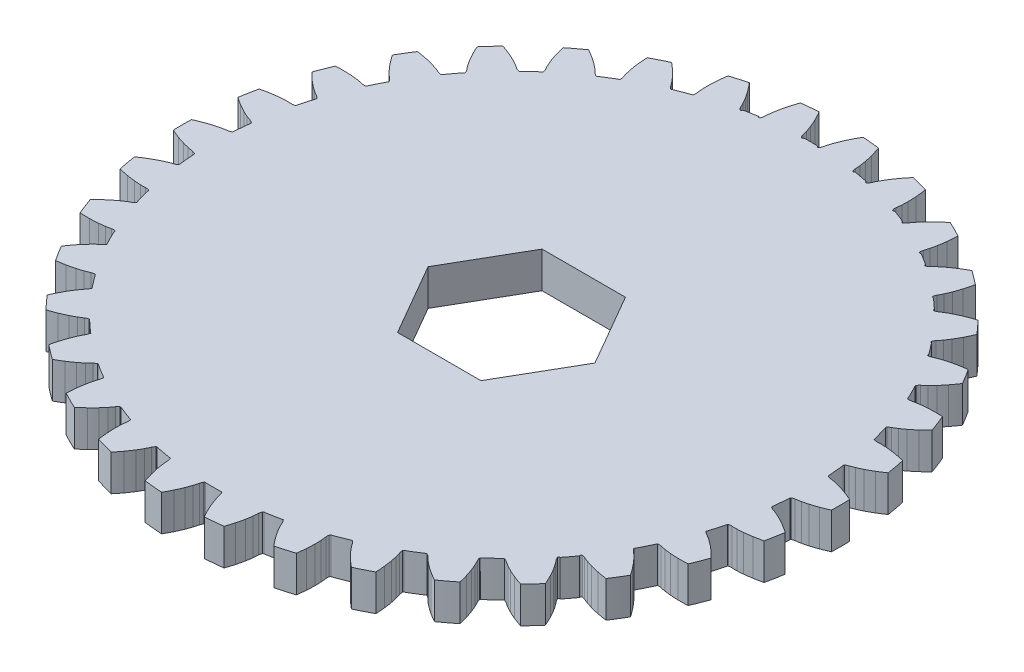
from build123d import *

# Parameters (mm, degrees)
BOSS_EXTRUDE1_DEPTH = 3.175


with BuildPart() as part:
    # Model → Boss-Extrude1 (new body)
    with BuildSketch(Plane(origin=(0, 0, 0), x_dir=(1, 0, 0), z_dir=(0, 1, 0))):
        with BuildLine():
            ThreePointArc((26.039547017, -3.158714239), (26.081656494, -2.789745335), (26.118538109, -2.420217249))
            ThreePointArc((26.118538109, -2.420217249), (26.15018278, -2.050225616), (26.176586464, -1.67982308))
            ThreePointArc((26.176586464, -1.67982308), (26.19430218, -1.656128647), (26.21828275, -1.638802221))
            ThreePointArc((26.21828275, -1.638802221), (26.349972724, -1.58470137), (26.488875474, -1.553473543))
            ThreePointArc((26.488875474, -1.553473543), (26.716015585, -1.517661861), (26.941580978, -1.472992407))
            ThreePointArc((26.941580978, -1.472992407), (27.208998909, -1.40997215), (27.474210372, -1.338231068))
            ThreePointArc((27.474210372, -1.338231068), (27.822373625, -1.230698091), (28.166198085, -1.110009516))
            ThreePointArc((28.166198085, -1.110009516), (28.547173014, -0.960699832), (28.922876054, -0.798581036))
            ThreePointArc((28.922876054, -0.798581036), (28.933898647, 0), (28.922876054, 0.798581036))
            ThreePointArc((28.922876054, 0.798581036), (28.547173011, 0.960699833), (28.166198079, 1.110009518))
            ThreePointArc((28.166198079, 1.110009518), (27.822373616, 1.230698094), (27.47421036, 1.338231071))
            ThreePointArc((27.47421036, 1.338231071), (27.208998897, 1.409972153), (26.941580965, 1.47299241))
            ThreePointArc((26.941580965, 1.47299241), (26.716015572, 1.517661864), (26.488875461, 1.553473545))
            ThreePointArc((26.488875461, 1.553473545), (26.349972724, 1.584701369), (26.218282762, 1.638802211))
            ThreePointArc((26.218282762, 1.638802211), (26.188796618, 1.65750247), (26.16748445, 1.685159727))
            ThreePointArc((26.16748445, 1.685159727), (26.111416775, 2.402273868), (26.035700465, 3.117580318))
            ThreePointArc((26.035700465, 3.117580318), (26.04260123, 3.167055317), (26.072995781, 3.206698314))
            ThreePointArc((26.072995781, 3.206698314), (26.192502478, 3.284075965), (26.323302047, 3.340295392))
            ThreePointArc((26.323302047, 3.340295392), (26.539994286, 3.417234198), (26.753511009, 3.502590602))
            ThreePointArc((26.753511009, 3.502590602), (27.0047957, 3.613675735), (27.252309044, 3.732927767))
            ThreePointArc((27.252309044, 3.732927767), (27.574785023, 3.902604621), (27.890578752, 4.084415822))
            ThreePointArc((27.890578752, 4.084415822), (28.237631276, 4.301187185), (28.577148007, 4.529580852))
            ThreePointArc((28.577148007, 4.529580852), (28.441244039, 5.316589925), (28.283670246, 6.099548205))
            ThreePointArc((28.283670246, 6.099548205), (27.884575011, 6.189871369), (27.482651318, 6.266634813))
            ThreePointArc((27.482651318, 6.266634813), (27.122504653, 6.322090857), (26.760510405, 6.36381805))
            ThreePointArc((26.760510405, 6.36381805), (26.486632282, 6.385605126), (26.212187706, 6.398414427))
            ThreePointArc((26.212187706, 6.398414427), (25.982255002, 6.400875766), (25.752402004, 6.394340799))
            ThreePointArc((25.752402004, 6.394340799), (25.610126253, 6.399513599), (25.470737559, 6.428495305))
            ThreePointArc((25.470737559, 6.428495305), (25.442493252, 6.434082805), (25.416780324, 6.447036816))
            ThreePointArc((25.416780324, 6.447036816), (25.227894102, 7.150549974), (25.019539308, 7.848544995))
            ThreePointArc((25.019539308, 7.848544995), (25.017231567, 7.8984456), (25.039824212, 7.942998585))
            ThreePointArc((25.039824212, 7.942998585), (25.143077974, 8.041018031), (25.261320139, 8.120314574))
            ThreePointArc((25.261320139, 8.120314574), (25.460185313, 8.235760445), (25.65438231, 8.358897088))
            ThreePointArc((25.65438231, 8.358897088), (25.880976562, 8.514264227), (26.102363017, 8.676966225))
            ThreePointArc((26.102363017, 8.676966225), (26.38817019, 8.903008813), (26.665179209, 9.139751279))
            ThreePointArc((26.665179209, 9.139751279), (26.966490872, 9.41660243), (27.258259459, 9.703493297))
            ThreePointArc((27.258259459, 9.703493297), (26.980056976, 10.452129756), (26.681297971, 11.192802576))
            ThreePointArc((26.681297971, 11.192802576), (26.272401252, 11.208254259), (25.863215829, 11.209857374))
            ThreePointArc((25.863215829, 11.209857374), (25.499011323, 11.198192398), (25.135513364, 11.172692838))
            ThreePointArc((25.135513364, 11.172692838), (24.862295171, 11.143783974), (24.590169834, 11.105946114))
            ThreePointArc((24.590169834, 11.105946114), (24.363699901, 11.06611552), (24.138961384, 11.017456446))
            ThreePointArc((24.138961384, 11.017456446), (23.998157648, 10.996398069), (23.855816937, 10.999273701))
            ThreePointArc((23.855816937, 10.999273701), (23.829640328, 10.995976243), (23.803412998, 10.998842458))
            ThreePointArc((23.803412998, 10.998842458), (23.486572972, 11.660098447), (23.151367748, 12.312236886))
            ThreePointArc((23.151367748, 12.312236886), (23.139930089, 12.360863792), (23.153951461, 12.408809565))
            ThreePointArc((23.153951461, 12.408809565), (23.237436106, 12.524132873), (23.339094271, 12.623806182))
            ThreePointArc((23.339094271, 12.623806182), (23.513360265, 12.773827747), (23.68162439, 12.93055136))
            ThreePointArc((23.68162439, 12.93055136), (23.875811807, 13.124909663), (24.063532324, 13.325521004))
            ThreePointArc((24.063532324, 13.325521004), (24.30293787, 13.600231718), (24.531728971, 13.883843467))
            ThreePointArc((24.531728971, 13.883843467), (24.793149492, 14.23368498), (25.041761869, 14.592741603))
            ThreePointArc((25.041761869, 14.592741603), (24.642190217, 15.257798213), (24.224960364, 15.911921328))
            ThreePointArc((24.224960364, 15.911921328), (23.79272998, 15.849417962), (23.363039544, 15.771341688))
            ThreePointArc((23.363039544, 15.771341688), (23.007179746, 15.692952927), (22.654556562, 15.601094971))
            ThreePointArc((22.654556562, 15.601094971), (22.391302418, 15.522474625), (22.13076322, 15.435278127))
            ThreePointArc((22.13076322, 15.435278127), (21.91546822, 15.354511984), (21.703497385, 15.265385829))
            ThreePointArc((21.703497385, 15.265385829), (21.568960567, 15.218813392), (21.428515081, 15.195485023))
            ThreePointArc((21.428515081, 15.195485023), (21.339460922, 15.238312212), (21.332995773, 15.336917553))
            ThreePointArc((21.332995773, 15.336917553), (20.967023721, 15.833561348), (20.58949199, 16.321475677))
            ThreePointArc((20.58949199, 16.321475677), (20.496420127, 16.354678643), (20.479598664, 16.452053418))
            ThreePointArc((20.479598664, 16.452053418), (20.540471221, 16.580753391), (20.622083541, 16.697409211))
            ThreePointArc((20.622083541, 16.697409211), (20.765815935, 16.876897667), (20.902417155, 17.061871214))
            ThreePointArc((20.902417155, 17.061871214), (21.057584918, 17.288602041), (21.205246899, 17.520291148))
            ThreePointArc((21.205246899, 17.520291148), (21.390098149, 17.834315043), (21.562880125, 18.155138018))
            ThreePointArc((21.562880125, 18.155138018), (21.758877489, 18.554118686), (21.940072505, 18.960036049))
            ThreePointArc((21.940072505, 18.960036049), (21.42934408, 19.535428351), (20.903530375, 20.097068602))
            ThreePointArc((20.903530375, 20.097068602), (20.482626013, 19.95409986), (20.067262968, 19.795751876))
            ThreePointArc((20.067262968, 19.795751876), (19.731866256, 19.653308767), (19.402126007, 19.498220527))
            ThreePointArc((19.402126007, 19.498220527), (19.157800716, 19.372566019), (18.917720007, 19.238980255))
            ThreePointArc((18.917720007, 19.238980255), (18.720931554, 19.120028957), (18.528946813, 18.993470805))
            ThreePointArc((18.528946813, 18.993470805), (18.405258403, 18.922970277), (18.271490845, 18.874232328))
            ThreePointArc((18.271490845, 18.874232328), (18.171589021, 18.904840123), (18.156103069, 19.008171613))
            ThreePointArc((18.156103069, 19.008171613), (17.70877484, 19.425600644), (17.251852246, 19.832505158))
            ThreePointArc((17.251852246, 19.832505158), (17.147532701, 19.838390811), (17.107837696, 19.935042324))
            ThreePointArc((17.107837696, 19.935042324), (17.144025225, 20.072736238), (17.202812489, 20.202401996))
            ThreePointArc((17.202812489, 20.202401996), (17.311116648, 20.405245077), (17.411403173, 20.612169507))
            ThreePointArc((17.411403173, 20.612169507), (17.52226723, 20.863551813), (17.624842223, 21.11842879))
            ThreePointArc((17.624842223, 21.11842879), (17.748844291, 21.46107216), (17.859733257, 21.808181118))
            ThreePointArc((17.859733257, 21.808181118), (17.980764446, 22.242890471), (18.085486232, 22.681814289))
            ThreePointArc((18.085486232, 22.681814289), (17.482113088, 23.150059043), (16.866622377, 23.602257546))
            ThreePointArc((16.866622377, 23.602257546), (16.473112668, 23.381416241), (16.08811982, 23.146041476))
            ThreePointArc((16.08811982, 23.146041476), (15.784607727, 22.944394748), (15.488979322, 22.731357568))
            ThreePointArc((15.488979322, 22.731357568), (15.271903088, 22.562947913), (15.060456529, 22.387521986))
            ThreePointArc((15.060456529, 22.387521986), (14.888876017, 22.234436276), (14.723415181, 22.074755914))
            ThreePointArc((14.723415181, 22.074755914), (14.614787239, 21.982728105), (14.492252902, 21.910240288))
            ThreePointArc((14.492252902, 21.910240288), (14.384331279, 21.925436409), (14.357220474, 22.030996833))
            ThreePointArc((14.357220474, 22.030996833), (13.843210143, 22.357552059), (13.321775772, 22.672117048))
            ThreePointArc((13.321775772, 22.672117048), (13.215197647, 22.649333307), (13.153489834, 22.739167273))
            ThreePointArc((13.153489834, 22.739167273), (13.163760011, 22.881166128), (13.19772029, 23.019426211))
            ThreePointArc((13.19772029, 23.019426211), (13.266908047, 23.238716341), (13.327464739, 23.460545089))
            ThreePointArc((13.327464739, 23.460545089), (13.390249747, 23.72801835), (13.444244684, 23.997403668))
            ThreePointArc((13.444244684, 23.997403668), (13.503174827, 24.356998204), (13.548394595, 24.718572767))
            ThreePointArc((13.548394595, 24.718572767), (13.587856271, 25.173548487), (13.610103634, 25.629690114))
            ThreePointArc((13.610103634, 25.629690114), (12.934985606, 25.976952933), (12.251014386, 26.306436148))
            ThreePointArc((12.251014386, 26.306436148), (11.900412538, 26.013795623), (11.561115047, 25.708120395))
            ThreePointArc((11.561115047, 25.708120395), (11.299823313, 25.454136884), (11.048374022, 25.190405491))
            ThreePointArc((11.048374022, 25.190405491), (10.865939117, 24.984975676), (10.690327267, 24.773683506))
            ThreePointArc((10.690327267, 24.773683506), (10.549797665, 24.591676535), (10.416495303, 24.404311685))
            ThreePointArc((10.416495303, 24.404311685), (10.326627024, 24.293890493), (10.219498669, 24.200121294))
            ThreePointArc((10.219498669, 24.200121294), (10.107150905, 24.197432846), (10.066174138, 24.302075822))
            ThreePointArc((10.066174138, 24.302075822), (9.502226677, 24.528074511), (8.933210143, 24.740988412))
            ThreePointArc((8.933210143, 24.740988412), (8.83243045, 24.691262183), (8.751215652, 24.768937153))
            ThreePointArc((8.751215652, 24.768937153), (8.735218739, 24.910405347), (8.743195555, 25.052551475))
            ThreePointArc((8.743195555, 25.052551475), (8.770910804, 25.28082099), (8.789675477, 25.509999946))
            ThreePointArc((8.789675477, 25.509999946), (8.802243369, 25.784455681), (8.805819518, 26.059175746))
            ThreePointArc((8.805819518, 26.059175746), (8.79767094, 26.423475887), (8.775681604, 26.787203066))
            ThreePointArc((8.775681604, 26.787203066), (8.730404112, 27.245633562), (8.667692096, 27.702005969))
            ThreePointArc((8.667692096, 27.702005969), (7.943442572, 27.918304767), (7.213806571, 28.115672066))
            ThreePointArc((7.213806571, 28.115672066), (6.920238625, 27.760670045), (6.640410367, 27.394740107))
            ThreePointArc((6.640410367, 27.394740107), (6.430236969, 27.097068918), (6.231529597, 26.791624367))
            ThreePointArc((6.231529597, 26.791624367), (6.089948622, 26.55617006), (5.956151732, 26.316206947))
            ThreePointArc((5.956151732, 26.316206947), (5.851458606, 26.111476744), (5.754854171, 25.902807892))
            ThreePointArc((5.754854171, 25.902807892), (5.686805911, 25.777753578), (5.598731665, 25.665896194))
            ThreePointArc((5.598731665, 25.665896194), (5.486245297, 25.643734929), (5.429734672, 25.743488896))
            ThreePointArc((5.429734672, 25.743488896), (4.834425845, 25.86189409), (4.236544006, 25.966534887))
            ThreePointArc((4.236544006, 25.966534887), (4.14781415, 25.893931074), (4.050929317, 25.955230586))
            ThreePointArc((4.050929317, 25.955230586), (4.009210069, 26.09135059), (3.990931782, 26.232542146))
            ThreePointArc((3.990931782, 26.232542146), (3.976230713, 26.462017603), (3.95256436, 26.69074235))
            ThreePointArc((3.95256436, 26.69074235), (3.91448715, 26.962834299), (3.867522728, 27.233533848))
            ThreePointArc((3.867522728, 27.233533848), (3.792572921, 27.59013379), (3.704123301, 27.943627293))
            ThreePointArc((3.704123301, 27.943627293), (3.57467779, 28.388184485), (3.428301751, 28.827458082))
            ThreePointArc((3.428301751, 28.827458082), (2.678605607, 28.906758109), (1.927103124, 28.966564621))
            ThreePointArc((1.927103124, 28.966564621), (1.702503102, 28.561667015), (1.493574476, 28.148464801))
            ThreePointArc((1.493574476, 28.148464801), (1.341676617, 27.817242769), (1.202477904, 27.480486608))
            ThreePointArc((1.202477904, 27.480486608), (1.10657223, 27.223025922), (1.019146593, 26.962563523))
            ThreePointArc((1.019146593, 26.962563523), (0.953855143, 26.74208193), (0.897238383, 26.519215043))
            ThreePointArc((0.897238383, 26.519215043), (0.853327443, 26.383786182), (0.787306569, 26.257649782))
            ThreePointArc((0.787306569, 26.257649782), (0.679502068, 26.215533389), (0.606763679, 26.305559649))
            ThreePointArc((0.606763679, 26.305559649), (-1.1e-08, 26.31255652), (-0.606763701, 26.305559649))
            ThreePointArc((-0.606763701, 26.305559649), (-0.679502069, 26.21553339), (-0.787306558, 26.25764977))
            ThreePointArc((-0.787306558, 26.25764977), (-0.853327442, 26.383786181), (-0.897238386, 26.519215057))
            ThreePointArc((-0.897238386, 26.519215057), (-0.953855146, 26.742081943), (-1.019146597, 26.962563536))
            ThreePointArc((-1.019146597, 26.962563536), (-1.106572234, 27.223025934), (-1.202477909, 27.480486619))
            ThreePointArc((-1.202477909, 27.480486619), (-1.341676621, 27.817242778), (-1.493574479, 28.148464807))
            ThreePointArc((-1.493574479, 28.148464807), (-1.702792839, 28.562213735), (-1.927724072, 28.967635045))
            ThreePointArc((-1.927724072, 28.967635045), (-2.67870796, 28.907862665), (-3.427888065, 28.828624379))
            ThreePointArc((-3.427888065, 28.828624379), (-3.574493448, 28.388775129), (-3.704123302, 27.943627286))
            ThreePointArc((-3.704123302, 27.943627286), (-3.792572923, 27.590133781), (-3.867522731, 27.233533837))
            ThreePointArc((-3.867522731, 27.233533837), (-3.914487151, 26.962834287), (-3.952564361, 26.690742337))
            ThreePointArc((-3.952564361, 26.690742337), (-3.976230714, 26.462017589), (-3.990931783, 26.232542133))
            ThreePointArc((-3.990931783, 26.232542133), (-4.009210067, 26.09135059), (-4.050929308, 25.955230599))
            ThreePointArc((-4.050929308, 25.955230599), (-4.14897935, 25.894009007), (-4.237117681, 25.968798903))
            ThreePointArc((-4.237117681, 25.968798903), (-4.834853424, 25.864181314), (-5.430017636, 25.745807254))
            ThreePointArc((-5.430017636, 25.745807254), (-5.485186935, 25.644228522), (-5.598731652, 25.665896185))
            ThreePointArc((-5.598731652, 25.665896185), (-5.686805909, 25.777753578), (-5.754854177, 25.902807905))
            ThreePointArc((-5.754854177, 25.902807905), (-5.851458612, 26.111476756), (-5.956151738, 26.316206959))
            ThreePointArc((-5.956151738, 26.316206959), (-6.089948628, 26.55617007), (-6.231529603, 26.791624377))
            ThreePointArc((-6.231529603, 26.791624377), (-6.430236974, 27.097068926), (-6.64041037, 27.394740112))
            ThreePointArc((-6.64041037, 27.394740112), (-6.921344677, 27.762060476), (-7.21612322, 28.118366447))
            ThreePointArc((-7.21612322, 28.118366447), (-7.944314362, 27.921368793), (-8.66714085, 27.705516336))
            ThreePointArc((-8.66714085, 27.705516336), (-8.730195696, 27.247397985), (-8.775681604, 26.787203059))
            ThreePointArc((-8.775681604, 26.787203059), (-8.79767094, 26.423475878), (-8.805819518, 26.059175734))
            ThreePointArc((-8.805819518, 26.059175734), (-8.802243368, 25.784455669), (-8.789675476, 25.509999932))
            ThreePointArc((-8.789675476, 25.509999932), (-8.770910802, 25.280820977), (-8.743195553, 25.052551462))
            ThreePointArc((-8.743195553, 25.052551462), (-8.735218737, 24.910405348), (-8.751215646, 24.768937167))
            ThreePointArc((-8.751215646, 24.768937167), (-8.743605771, 24.746062493), (-8.740091863, 24.722212684))
            ThreePointArc((-8.740091863, 24.722212684), (-9.435606495, 24.465206637), (-10.123576332, 24.188637994))
            ThreePointArc((-10.123576332, 24.188637994), (-10.173051139, 24.18173585), (-10.219498654, 24.200121288))
            ThreePointArc((-10.219498654, 24.200121288), (-10.326627022, 24.293890494), (-10.416495311, 24.404311697))
            ThreePointArc((-10.416495311, 24.404311697), (-10.549797673, 24.591676546), (-10.690327276, 24.773683516))
            ThreePointArc((-10.690327276, 24.773683516), (-10.865939125, 24.984975686), (-11.04837403, 25.190405499))
            ThreePointArc((-11.04837403, 25.190405499), (-11.299823319, 25.454136891), (-11.561115051, 25.7081204))
            ThreePointArc((-11.561115051, 25.7081204), (-11.864586738, 25.982602118), (-12.177174788, 26.246655122))
            ThreePointArc((-12.177174788, 26.246655122), (-12.896948409, 25.900563944), (-13.606895645, 25.534738726))
            ThreePointArc((-13.606895645, 25.534738726), (-13.584553185, 25.126160587), (-13.548394594, 24.71857276))
            ThreePointArc((-13.548394594, 24.71857276), (-13.503174826, 24.356998195), (-13.444244682, 23.997403656))
            ThreePointArc((-13.444244682, 23.997403656), (-13.390249744, 23.728018338), (-13.327464735, 23.460545076))
            ThreePointArc((-13.327464735, 23.460545076), (-13.266908043, 23.238716328), (-13.197720285, 23.019426198))
            ThreePointArc((-13.197720285, 23.019426198), (-13.16376001, 22.881166128), (-13.153489831, 22.739167288))
            ThreePointArc((-13.153489831, 22.739167288), (-13.142387478, 22.717653893), (-13.135326412, 22.694497258))
            ThreePointArc((-13.135326412, 22.694497258), (-13.771084204, 22.314440293), (-14.395853775, 21.916578196))
            ThreePointArc((-14.395853775, 21.916578196), (-14.443217913, 21.900702603), (-14.492252887, 21.910240285))
            ThreePointArc((-14.492252887, 21.910240285), (-14.614787238, 21.982728106), (-14.72341519, 22.074755923))
            ThreePointArc((-14.72341519, 22.074755923), (-14.888876027, 22.234436285), (-15.060456539, 22.387521994))
            ThreePointArc((-15.060456539, 22.387521994), (-15.271903098, 22.562947921), (-15.488979331, 22.731357575))
            ThreePointArc((-15.488979331, 22.731357575), (-15.784607734, 22.944394753), (-16.088119825, 23.14604148))
            ThreePointArc((-16.088119825, 23.14604148), (-16.436860213, 23.360086849), (-16.792645469, 23.562205946))
            ThreePointArc((-16.792645469, 23.562205946), (-17.43656949, 23.089749572), (-18.067208318, 22.599700761))
            ThreePointArc((-18.067208318, 22.599700761), (-17.970170244, 22.202184858), (-17.859733256, 21.808181112))
            ThreePointArc((-17.859733256, 21.808181112), (-17.748844288, 21.461072151), (-17.624842219, 21.118428779))
            ThreePointArc((-17.624842219, 21.118428779), (-17.522267225, 20.863551801), (-17.411403167, 20.612169495))
            ThreePointArc((-17.411403167, 20.612169495), (-17.311116642, 20.405245065), (-17.202812482, 20.202401984))
            ThreePointArc((-17.202812482, 20.202401984), (-17.144025224, 20.072736239), (-17.107837695, 19.935042339))
            ThreePointArc((-17.107837695, 19.935042339), (-17.093770168, 19.915068932), (-17.083717189, 19.892803039))
            ThreePointArc((-17.083717189, 19.892803039), (-17.637819927, 19.403203703), (-18.177897684, 18.898175614))
            ThreePointArc((-18.177897684, 18.898175614), (-18.221538225, 18.873867195), (-18.271490829, 18.874232327))
            ThreePointArc((-18.271490829, 18.874232327), (-18.405258402, 18.922970278), (-18.528946824, 18.993470813))
            ThreePointArc((-18.528946824, 18.993470813), (-18.720931566, 19.120028964), (-18.917720019, 19.238980262))
            ThreePointArc((-18.917720019, 19.238980262), (-19.157800727, 19.372566025), (-19.402126018, 19.498220532))
            ThreePointArc((-19.402126018, 19.498220532), (-19.731866264, 19.653308771), (-20.067262974, 19.795751879))
            ThreePointArc((-20.067262974, 19.795751879), (-20.449396127, 19.942071841), (-20.83626275, 20.075374106))
            ThreePointArc((-20.83626275, 20.075374106), (-21.38240911, 19.492641472), (-21.912263881, 18.895057092))
            ThreePointArc((-21.912263881, 18.895057092), (-21.743834709, 18.522140352), (-21.562880121, 18.155138012))
            ThreePointArc((-21.562880121, 18.155138012), (-21.390098145, 17.834315035), (-21.205246893, 17.520291138))
            ThreePointArc((-21.205246893, 17.520291138), (-21.057584911, 17.288602031), (-20.902417147, 17.061871203))
            ThreePointArc((-20.902417147, 17.061871203), (-20.765815926, 16.876897656), (-20.622083532, 16.697409201))
            ThreePointArc((-20.622083532, 16.697409201), (-20.54047122, 16.580753392), (-20.479598666, 16.452053433))
            ThreePointArc((-20.479598666, 16.452053433), (-20.463039822, 16.4334639), (-20.45057791, 16.411912408))
            ThreePointArc((-20.45057791, 16.411912408), (-20.904013632, 15.830325955), (-21.340915089, 15.236218327))
            ThreePointArc((-21.340915089, 15.236218327), (-21.379345906, 15.204304877), (-21.428515066, 15.195485025))
            ThreePointArc((-21.428515066, 15.195485025), (-21.568960566, 15.218813393), (-21.703497397, 15.265385834))
            ThreePointArc((-21.703497397, 15.265385834), (-21.915468233, 15.354511989), (-22.130763232, 15.435278131))
            ThreePointArc((-22.130763232, 15.435278131), (-22.39130243, 15.522474628), (-22.654556573, 15.601094975))
            ThreePointArc((-22.654556573, 15.601094975), (-23.007179754, 15.692952929), (-23.36303955, 15.771341689))
            ThreePointArc((-23.36303955, 15.771341689), (-23.765552383, 15.844953493), (-24.170326093, 15.904899479))
            ThreePointArc((-24.170326093, 15.904899479), (-24.600096433, 15.231734845), (-25.011123578, 14.546964916))
            ThreePointArc((-25.011123578, 14.546964916), (-24.777038962, 14.211346572), (-24.531728967, 13.883843462))
            ThreePointArc((-24.531728967, 13.883843462), (-24.302937864, 13.600231711), (-24.063532316, 13.325520995))
            ThreePointArc((-24.063532316, 13.325520995), (-23.875811799, 13.124909653), (-23.68162438, 12.930551351))
            ThreePointArc((-23.68162438, 12.930551351), (-23.513360255, 12.773827738), (-23.339094261, 12.623806174))
            ThreePointArc((-23.339094261, 12.623806174), (-23.237436105, 12.524132874), (-23.153951466, 12.408809579))
            ThreePointArc((-23.153951466, 12.408809579), (-23.135182164, 12.390988008), (-23.120861787, 12.369428279))
            ThreePointArc((-23.120861787, 12.369428279), (-23.458229944, 11.717015561), (-23.777193226, 11.055409899))
            ThreePointArc((-23.777193226, 11.055409899), (-23.809105605, 11.016978192), (-23.855816922, 10.999273706))
            ThreePointArc((-23.855816922, 10.999273706), (-23.998157647, 10.99639807), (-24.138961397, 11.017456449))
            ThreePointArc((-24.138961397, 11.017456449), (-24.363699914, 11.066115523), (-24.590169847, 11.105946116))
            ThreePointArc((-24.590169847, 11.105946116), (-24.862295184, 11.143783976), (-25.135513376, 11.172692839))
            ThreePointArc((-25.135513376, 11.172692839), (-25.499011332, 11.198192398), (-25.863215835, 11.209857374))
            ThreePointArc((-25.863215835, 11.209857374), (-26.272401256, 11.208254259), (-26.681297971, 11.192802576))
            ThreePointArc((-26.681297971, 11.192802576), (-26.980056976, 10.452129756), (-27.258259459, 9.703493297))
            ThreePointArc((-27.258259459, 9.703493297), (-26.966490869, 9.416602428), (-26.665179204, 9.139751274))
            ThreePointArc((-26.665179204, 9.139751274), (-26.388170183, 8.903008807), (-26.102363008, 8.676966218))
            ThreePointArc((-26.102363008, 8.676966218), (-25.880976551, 8.51426422), (-25.654382299, 8.358897081))
            ThreePointArc((-25.654382299, 8.358897081), (-25.460185302, 8.235760438), (-25.261320127, 8.120314568))
            ThreePointArc((-25.261320127, 8.120314568), (-25.143077974, 8.041018033), (-25.03982422, 7.942998598))
            ThreePointArc((-25.03982422, 7.942998598), (-25.018642166, 7.924542889), (-25.002947755, 7.901240999))
            ThreePointArc((-25.002947755, 7.901240999), (-25.213120048, 7.202470632), (-25.403767565, 6.498122747))
            ThreePointArc((-25.403767565, 6.498122747), (-25.428074768, 6.454481528), (-25.470737545, 6.428495312))
            ThreePointArc((-25.470737545, 6.428495312), (-25.610126252, 6.3995136), (-25.752402018, 6.394340799))
            ThreePointArc((-25.752402018, 6.394340799), (-25.982255016, 6.400875766), (-26.21218772, 6.398414426))
            ThreePointArc((-26.21218772, 6.398414426), (-26.486632294, 6.385605125), (-26.760510417, 6.363818049))
            ThreePointArc((-26.760510417, 6.363818049), (-27.122504662, 6.322090855), (-27.482651325, 6.266634811))
            ThreePointArc((-27.482651325, 6.266634811), (-27.884575014, 6.189871368), (-28.283670246, 6.099548205))
            ThreePointArc((-28.283670246, 6.099548205), (-28.441244039, 5.316589925), (-28.577148007, 4.529580852))
            ThreePointArc((-28.577148007, 4.529580852), (-28.237631273, 4.301187183), (-27.890578746, 4.084415819))
            ThreePointArc((-27.890578746, 4.084415819), (-27.574785015, 3.902604616), (-27.252309033, 3.732927762))
            ThreePointArc((-27.252309033, 3.732927762), (-27.004795688, 3.61367573), (-26.753510997, 3.502590596))
            ThreePointArc((-26.753510997, 3.502590596), (-26.539994274, 3.417234193), (-26.323302034, 3.340295388))
            ThreePointArc((-26.323302034, 3.340295388), (-26.192502478, 3.284075966), (-26.072995791, 3.206698326))
            ThreePointArc((-26.072995791, 3.206698326), (-26.04762693, 3.183829267), (-26.031336753, 3.153809223))
            ThreePointArc((-26.031336753, 3.153809223), (-26.108142708, 2.437599245), (-26.165247069, 1.719549818))
            ThreePointArc((-26.165247069, 1.719549818), (-26.181121342, 1.672185237), (-26.21828275, 1.638802221))
            ThreePointArc((-26.21828275, 1.638802221), (-26.349972724, 1.58470137), (-26.488875474, 1.553473543))
            ThreePointArc((-26.488875474, 1.553473543), (-26.716015585, 1.517661861), (-26.941580978, 1.472992407))
            ThreePointArc((-26.941580978, 1.472992407), (-27.208998909, 1.40997215), (-27.474210372, 1.338231068))
            ThreePointArc((-27.474210372, 1.338231068), (-27.822373625, 1.230698091), (-28.166198085, 1.110009516))
            ThreePointArc((-28.166198085, 1.110009516), (-28.547173014, 0.960699832), (-28.922876054, 0.798581036))
            ThreePointArc((-28.922876054, 0.798581036), (-28.933898647, 0), (-28.922876054, -0.798581036))
            ThreePointArc((-28.922876054, -0.798581036), (-28.547173011, -0.960699833), (-28.166198079, -1.110009518))
            ThreePointArc((-28.166198079, -1.110009518), (-27.822373616, -1.230698094), (-27.47421036, -1.338231071))
            ThreePointArc((-27.47421036, -1.338231071), (-27.208998897, -1.409972153), (-26.941580965, -1.47299241))
            ThreePointArc((-26.941580965, -1.47299241), (-26.716015572, -1.517661864), (-26.488875461, -1.553473545))
            ThreePointArc((-26.488875461, -1.553473545), (-26.349972724, -1.584701369), (-26.218282762, -1.638802211))
            ThreePointArc((-26.218282762, -1.638802211), (-26.171313035, -1.691469631), (-26.17191353, -1.762036278))
            ThreePointArc((-26.17191353, -1.762036278), (-26.115359118, -2.46208201), (-26.040083277, -3.160362739))
            ThreePointArc((-26.040083277, -3.160362739), (-26.053106056, -3.185969348), (-26.072995781, -3.206698314))
            ThreePointArc((-26.072995781, -3.206698314), (-26.192502478, -3.284075965), (-26.323302047, -3.340295392))
            ThreePointArc((-26.323302047, -3.340295392), (-26.539994286, -3.417234198), (-26.753511009, -3.502590602))
            ThreePointArc((-26.753511009, -3.502590602), (-27.0047957, -3.613675735), (-27.252309044, -3.732927767))
            ThreePointArc((-27.252309044, -3.732927767), (-27.574785023, -3.902604621), (-27.890578752, -4.084415822))
            ThreePointArc((-27.890578752, -4.084415822), (-28.246780691, -4.307125444), (-28.595028735, -4.542077985))
            ThreePointArc((-28.595028735, -4.542077985), (-28.460528252, -5.320194769), (-28.304858014, -6.09435424))
            ThreePointArc((-28.304858014, -6.09435424), (-27.895251733, -6.187639257), (-27.482651318, -6.266634813))
            ThreePointArc((-27.482651318, -6.266634813), (-27.122504653, -6.322090857), (-26.760510405, -6.36381805))
            ThreePointArc((-26.760510405, -6.36381805), (-26.486632282, -6.385605126), (-26.212187706, -6.398414427))
            ThreePointArc((-26.212187706, -6.398414427), (-25.982255002, -6.400875766), (-25.752402004, -6.394340799))
            ThreePointArc((-25.752402004, -6.394340799), (-25.610126253, -6.399513599), (-25.470737559, -6.428495305))
            ThreePointArc((-25.470737559, -6.428495305), (-25.407829004, -6.485741359), (-25.413393337, -6.570615591))
            ThreePointArc((-25.413393337, -6.570615591), (-25.228374999, -7.248630563), (-25.025271088, -7.921449178))
            ThreePointArc((-25.025271088, -7.921449178), (-25.031829598, -7.932708809), (-25.039824212, -7.942998585))
            ThreePointArc((-25.039824212, -7.942998585), (-25.143077974, -8.041018031), (-25.261320139, -8.120314574))
            ThreePointArc((-25.261320139, -8.120314574), (-25.460185313, -8.235760445), (-25.65438231, -8.358897088))
            ThreePointArc((-25.65438231, -8.358897088), (-25.880976562, -8.514264227), (-26.102363017, -8.676966225))
            ThreePointArc((-26.102363017, -8.676966225), (-26.38817019, -8.903008813), (-26.665179209, -9.139751279))
            ThreePointArc((-26.665179209, -9.139751279), (-26.981883595, -9.431259495), (-27.28800839, -9.733858764))
            ThreePointArc((-27.28800839, -9.733858764), (-27.015692033, -10.465934851), (-26.723739779, -11.19040395))
            ThreePointArc((-26.723739779, -11.19040395), (-26.293651012, -11.207792568), (-25.863215829, -11.209857374))
            ThreePointArc((-25.863215829, -11.209857374), (-25.499011323, -11.198192398), (-25.135513364, -11.172692838))
            ThreePointArc((-25.135513364, -11.172692838), (-24.862295171, -11.143783974), (-24.590169834, -11.105946114))
            ThreePointArc((-24.590169834, -11.105946114), (-24.363699901, -11.06611552), (-24.138961384, -11.017456446))
            ThreePointArc((-24.138961384, -11.017456446), (-23.998157648, -10.996398069), (-23.855816937, -10.999273701))
            ThreePointArc((-23.855816937, -10.999273701), (-23.778189878, -11.053330716), (-23.782445156, -11.147829466))
            ThreePointArc((-23.782445156, -11.147829466), (-23.475469745, -11.780539871), (-23.151665373, -12.404805111))
            ThreePointArc((-23.151665373, -12.404805111), (-23.152784857, -12.406820788), (-23.153951461, -12.408809565))
            ThreePointArc((-23.153951461, -12.408809565), (-23.237436106, -12.524132873), (-23.339094271, -12.623806182))
            ThreePointArc((-23.339094271, -12.623806182), (-23.513360265, -12.773827747), (-23.68162439, -12.93055136))
            ThreePointArc((-23.68162439, -12.93055136), (-23.875811807, -13.124909663), (-24.063532324, -13.325521004))
            ThreePointArc((-24.063532324, -13.325521004), (-24.30293787, -13.600231718), (-24.531728971, -13.883843467))
            ThreePointArc((-24.531728971, -13.883843467), (-24.777038964, -14.211346574), (-25.011123578, -14.546964916))
            ThreePointArc((-25.011123578, -14.546964916), (-24.600096433, -15.231734845), (-24.170326093, -15.904899479))
            ThreePointArc((-24.170326093, -15.904899479), (-23.765552379, -15.844953493), (-23.363039544, -15.771341688))
            ThreePointArc((-23.363039544, -15.771341688), (-23.007179746, -15.692952927), (-22.654556562, -15.601094971))
            ThreePointArc((-22.654556562, -15.601094971), (-22.391302418, -15.522474625), (-22.13076322, -15.435278127))
            ThreePointArc((-22.13076322, -15.435278127), (-21.91546822, -15.354511984), (-21.703497385, -15.265385829))
            ThreePointArc((-21.703497385, -15.265385829), (-21.568960567, -15.218813392), (-21.428515081, -15.195485023))
            ThreePointArc((-21.428515081, -15.195485023), (-21.379345923, -15.20430487), (-21.3409151, -15.236218311))
            ThreePointArc((-21.3409151, -15.236218311), (-20.904013639, -15.830325945), (-20.450577914, -16.411912404))
            ThreePointArc((-20.450577914, -16.411912404), (-20.463039823, -16.43346389), (-20.479598664, -16.452053418))
            ThreePointArc((-20.479598664, -16.452053418), (-20.540471221, -16.580753391), (-20.622083541, -16.697409211))
            ThreePointArc((-20.622083541, -16.697409211), (-20.765815935, -16.876897667), (-20.902417155, -17.061871214))
            ThreePointArc((-20.902417155, -17.061871214), (-21.057584918, -17.288602041), (-21.205246899, -17.520291148))
            ThreePointArc((-21.205246899, -17.520291148), (-21.390098149, -17.834315043), (-21.562880125, -18.155138018))
            ThreePointArc((-21.562880125, -18.155138018), (-21.743834711, -18.522140355), (-21.912263881, -18.895057092))
            ThreePointArc((-21.912263881, -18.895057092), (-21.38240911, -19.492641472), (-20.83626275, -20.075374106))
            ThreePointArc((-20.83626275, -20.075374106), (-20.449396124, -19.94207184), (-20.067262968, -19.795751876))
            ThreePointArc((-20.067262968, -19.795751876), (-19.731866256, -19.653308767), (-19.402126007, -19.498220527))
            ThreePointArc((-19.402126007, -19.498220527), (-19.157800716, -19.372566019), (-18.917720007, -19.238980255))
            ThreePointArc((-18.917720007, -19.238980255), (-18.720931554, -19.120028957), (-18.528946813, -18.993470805))
            ThreePointArc((-18.528946813, -18.993470805), (-18.405258403, -18.922970277), (-18.271490845, -18.874232328))
            ThreePointArc((-18.271490845, -18.874232328), (-18.221538242, -18.873867192), (-18.177897698, -18.8981756))
            ThreePointArc((-18.177897698, -18.8981756), (-17.637819937, -19.403203695), (-17.083717193, -19.892803035))
            ThreePointArc((-17.083717193, -19.892803035), (-17.093770171, -19.915068922), (-17.107837696, -19.935042324))
            ThreePointArc((-17.107837696, -19.935042324), (-17.144025225, -20.072736238), (-17.202812489, -20.202401996))
            ThreePointArc((-17.202812489, -20.202401996), (-17.311116648, -20.405245077), (-17.411403173, -20.612169507))
            ThreePointArc((-17.411403173, -20.612169507), (-17.52226723, -20.863551813), (-17.624842223, -21.11842879))
            ThreePointArc((-17.624842223, -21.11842879), (-17.748844291, -21.46107216), (-17.859733257, -21.808181118))
            ThreePointArc((-17.859733257, -21.808181118), (-17.970170245, -22.202184861), (-18.067208318, -22.599700761))
            ThreePointArc((-18.067208318, -22.599700761), (-17.43656949, -23.089749572), (-16.792645469, -23.562205946))
            ThreePointArc((-16.792645469, -23.562205946), (-16.43686021, -23.360086848), (-16.08811982, -23.146041476))
            ThreePointArc((-16.08811982, -23.146041476), (-15.784607727, -22.944394748), (-15.488979322, -22.731357568))
            ThreePointArc((-15.488979322, -22.731357568), (-15.271903088, -22.562947913), (-15.060456529, -22.387521986))
            ThreePointArc((-15.060456529, -22.387521986), (-14.888876017, -22.234436276), (-14.723415181, -22.074755914))
            ThreePointArc((-14.723415181, -22.074755914), (-14.614787239, -21.982728105), (-14.492252902, -21.910240288))
            ThreePointArc((-14.492252902, -21.910240288), (-14.443217931, -21.900702602), (-14.395853792, -21.916578185))
            ThreePointArc((-14.395853792, -21.916578185), (-13.771084215, -22.314440286), (-13.135326417, -22.694497255))
            ThreePointArc((-13.135326417, -22.694497255), (-13.142387483, -22.717653884), (-13.153489834, -22.739167273))
            ThreePointArc((-13.153489834, -22.739167273), (-13.163760011, -22.881166128), (-13.19772029, -23.019426211))
            ThreePointArc((-13.19772029, -23.019426211), (-13.266908047, -23.238716341), (-13.327464739, -23.460545089))
            ThreePointArc((-13.327464739, -23.460545089), (-13.390249747, -23.72801835), (-13.444244684, -23.997403668))
            ThreePointArc((-13.444244684, -23.997403668), (-13.503174827, -24.356998204), (-13.548394595, -24.718572767))
            ThreePointArc((-13.548394595, -24.718572767), (-13.584553185, -25.126160591), (-13.606895645, -25.534738726))
            ThreePointArc((-13.606895645, -25.534738726), (-12.896948409, -25.900563944), (-12.177174788, -26.246655122))
            ThreePointArc((-12.177174788, -26.246655122), (-11.864586735, -25.982602116), (-11.561115047, -25.708120395))
            ThreePointArc((-11.561115047, -25.708120395), (-11.299823313, -25.454136884), (-11.048374022, -25.190405491))
            ThreePointArc((-11.048374022, -25.190405491), (-10.865939117, -24.984975676), (-10.690327267, -24.773683506))
            ThreePointArc((-10.690327267, -24.773683506), (-10.549797665, -24.591676535), (-10.416495303, -24.404311685))
            ThreePointArc((-10.416495303, -24.404311685), (-10.326627024, -24.293890493), (-10.219498669, -24.200121294))
            ThreePointArc((-10.219498669, -24.200121294), (-10.173051156, -24.181735853), (-10.123576351, -24.188637986))
            ThreePointArc((-10.123576351, -24.188637986), (-9.435606507, -24.465206633), (-8.740091869, -24.722212682))
            ThreePointArc((-8.740091869, -24.722212682), (-8.743605778, -24.746062484), (-8.751215652, -24.768937153))
            ThreePointArc((-8.751215652, -24.768937153), (-8.735218739, -24.910405347), (-8.743195555, -25.052551475))
            ThreePointArc((-8.743195555, -25.052551475), (-8.770910804, -25.28082099), (-8.789675477, -25.509999946))
            ThreePointArc((-8.789675477, -25.509999946), (-8.802243369, -25.784455681), (-8.805819518, -26.059175746))
            ThreePointArc((-8.805819518, -26.059175746), (-8.79767094, -26.423475887), (-8.775681604, -26.787203066))
            ThreePointArc((-8.775681604, -26.787203066), (-8.736330459, -27.194495056), (-8.683216461, -27.600221789))
            ThreePointArc((-8.683216461, -27.600221789), (-7.918137218, -27.829365675), (-7.147025024, -28.037305937))
            ThreePointArc((-7.147025024, -28.037305937), (-6.888278989, -27.720311031), (-6.640410367, -27.394740107))
            ThreePointArc((-6.640410367, -27.394740107), (-6.430236969, -27.097068918), (-6.231529597, -26.791624367))
            ThreePointArc((-6.231529597, -26.791624367), (-6.089948622, -26.55617006), (-5.956151732, -26.316206947))
            ThreePointArc((-5.956151732, -26.316206947), (-5.851458606, -26.111476744), (-5.754854171, -25.902807892))
            ThreePointArc((-5.754854171, -25.902807892), (-5.686805911, -25.777753578), (-5.598731665, -25.665896194))
            ThreePointArc((-5.598731665, -25.665896194), (-5.556453326, -25.639289092), (-5.506552659, -25.636982731))
            ThreePointArc((-5.506552659, -25.636982731), (-4.779095632, -25.782498922), (-4.047813195, -25.9073776))
            ThreePointArc((-4.047813195, -25.9073776), (-4.047307159, -25.931438504), (-4.050929317, -25.955230586))
            ThreePointArc((-4.050929317, -25.955230586), (-4.009210069, -26.09135059), (-3.990931782, -26.232542146))
            ThreePointArc((-3.990931782, -26.232542146), (-3.976230713, -26.462017603), (-3.95256436, -26.69074235))
            ThreePointArc((-3.95256436, -26.69074235), (-3.91448715, -26.962834299), (-3.867522728, -27.233533848))
            ThreePointArc((-3.867522728, -27.233533848), (-3.792572921, -27.59013379), (-3.704123301, -27.943627293))
            ThreePointArc((-3.704123301, -27.943627293), (-3.590602477, -28.336753609), (-3.463840755, -28.725812401))
            ThreePointArc((-3.463840755, -28.725812401), (-2.669683361, -28.810471736), (-1.873491894, -28.873179926))
            ThreePointArc((-1.873491894, -28.873179926), (-1.677399164, -28.514038001), (-1.493574476, -28.148464801))
            ThreePointArc((-1.493574476, -28.148464801), (-1.341676617, -27.817242769), (-1.202477904, -27.480486608))
            ThreePointArc((-1.202477904, -27.480486608), (-1.10657223, -27.223025922), (-1.019146593, -26.962563523))
            ThreePointArc((-1.019146593, -26.962563523), (-0.953855143, -26.74208193), (-0.897238383, -26.519215043))
            ThreePointArc((-0.897238383, -26.519215043), (-0.853327443, -26.383786182), (-0.787306569, -26.257649782))
            ThreePointArc((-0.787306569, -26.257649782), (-0.750637141, -26.223727091), (-0.702009921, -26.212290778))
            ThreePointArc((-0.702009921, -26.212290778), (0.039844092, -26.221659333), (0.781666207, -26.210036316))
            ThreePointArc((0.781666207, -26.210036316), (0.786536431, -26.233600192), (0.787306558, -26.25764977))
            ThreePointArc((0.787306558, -26.25764977), (0.853327442, -26.383786181), (0.897238386, -26.519215057))
            ThreePointArc((0.897238386, -26.519215057), (0.953855146, -26.742081943), (1.019146597, -26.962563536))
            ThreePointArc((1.019146597, -26.962563536), (1.106572234, -27.223025934), (1.202477909, -27.480486619))
            ThreePointArc((1.202477909, -27.480486619), (1.341676621, -27.817242778), (1.493574479, -28.148464807))
            ThreePointArc((1.493574479, -28.148464807), (1.677399165, -28.514038004), (1.873491894, -28.873179926))
            ThreePointArc((1.873491894, -28.873179926), (2.669683361, -28.810471736), (3.463840755, -28.725812401))
            ThreePointArc((3.463840755, -28.725812401), (3.590602478, -28.336753606), (3.704123302, -27.943627286))
            ThreePointArc((3.704123302, -27.943627286), (3.792572923, -27.590133781), (3.867522731, -27.233533837))
            ThreePointArc((3.867522731, -27.233533837), (3.914487151, -26.962834287), (3.952564361, -26.690742337))
            ThreePointArc((3.952564361, -26.690742337), (3.976230714, -26.462017589), (3.990931783, -26.232542133))
            ThreePointArc((3.990931783, -26.232542133), (4.009210067, -26.09135059), (4.050929308, -25.955230599))
            ThreePointArc((4.050929308, -25.955230599), (4.080741091, -25.915147517), (4.126438924, -25.8949707))
            ThreePointArc((4.126438924, -25.8949707), (4.857105698, -25.767916679), (5.583887106, -25.620250009))
            ThreePointArc((5.583887106, -25.620250009), (5.593298057, -25.642426361), (5.598731652, -25.665896185))
            ThreePointArc((5.598731652, -25.665896185), (5.686805909, -25.777753578), (5.754854177, -25.902807905))
            ThreePointArc((5.754854177, -25.902807905), (5.851458612, -26.111476756), (5.956151738, -26.316206959))
            ThreePointArc((5.956151738, -26.316206959), (6.089948628, -26.55617007), (6.231529603, -26.791624377))
            ThreePointArc((6.231529603, -26.791624377), (6.430236974, -27.097068926), (6.64041037, -27.394740112))
            ThreePointArc((6.64041037, -27.394740112), (6.888278991, -27.720311034), (7.147025024, -28.037305937))
            ThreePointArc((7.147025024, -28.037305937), (7.918137218, -27.829365675), (8.683216461, -27.600221789))
            ThreePointArc((8.683216461, -27.600221789), (8.736330459, -27.194495053), (8.775681604, -26.787203059))
            ThreePointArc((8.775681604, -26.787203059), (8.79767094, -26.423475878), (8.805819518, -26.059175734))
            ThreePointArc((8.805819518, -26.059175734), (8.802243368, -25.784455669), (8.789675476, -25.509999932))
            ThreePointArc((8.789675476, -25.509999932), (8.770910802, -25.280820977), (8.743195553, -25.052551462))
            ThreePointArc((8.743195553, -25.052551462), (8.735218737, -24.910405348), (8.751215646, -24.768937167))
            ThreePointArc((8.751215646, -24.768937167), (8.77315458, -24.724058676), (8.814366839, -24.695828453))
            ThreePointArc((8.814366839, -24.695828453), (9.508665685, -24.436904113), (10.195370997, -24.158464686))
            ThreePointArc((10.195370997, -24.158464686), (10.209296404, -24.178214754), (10.219498654, -24.200121288))
            ThreePointArc((10.219498654, -24.200121288), (10.326627022, -24.293890494), (10.416495311, -24.404311697))
            ThreePointArc((10.416495311, -24.404311697), (10.549797673, -24.591676546), (10.690327276, -24.773683516))
            ThreePointArc((10.690327276, -24.773683516), (10.865939125, -24.984975686), (11.04837403, -25.190405499))
            ThreePointArc((11.04837403, -25.190405499), (11.299823319, -25.454136891), (11.561115051, -25.7081204))
            ThreePointArc((11.561115051, -25.7081204), (11.864586738, -25.982602118), (12.177174788, -26.246655122))
            ThreePointArc((12.177174788, -26.246655122), (12.896948409, -25.900563944), (13.606895645, -25.534738726))
            ThreePointArc((13.606895645, -25.534738726), (13.584553185, -25.126160587), (13.548394594, -24.71857276))
            ThreePointArc((13.548394594, -24.71857276), (13.503174826, -24.356998195), (13.444244682, -23.997403656))
            ThreePointArc((13.444244682, -23.997403656), (13.390249744, -23.728018338), (13.327464735, -23.460545076))
            ThreePointArc((13.327464735, -23.460545076), (13.266908043, -23.238716328), (13.197720285, -23.019426198))
            ThreePointArc((13.197720285, -23.019426198), (13.16376001, -22.881166128), (13.153489831, -22.739167288))
            ThreePointArc((13.153489831, -22.739167288), (13.166808812, -22.69102167), (13.202132064, -22.655699387))
            ThreePointArc((13.202132064, -22.655699387), (13.836172166, -22.274140737), (14.459192988, -21.874842717))
            ThreePointArc((14.459192988, -21.874842717), (14.477368933, -21.891004208), (14.492252887, -21.910240285))
            ThreePointArc((14.492252887, -21.910240285), (14.614787238, -21.982728106), (14.72341519, -22.074755923))
            ThreePointArc((14.72341519, -22.074755923), (14.888876027, -22.234436285), (15.060456539, -22.387521994))
            ThreePointArc((15.060456539, -22.387521994), (15.271903098, -22.562947921), (15.488979331, -22.731357575))
            ThreePointArc((15.488979331, -22.731357575), (15.784607734, -22.944394753), (16.088119825, -23.14604148))
            ThreePointArc((16.088119825, -23.14604148), (16.436860213, -23.360086849), (16.792645469, -23.562205946))
            ThreePointArc((16.792645469, -23.562205946), (17.43656949, -23.089749572), (18.067208318, -22.599700761))
            ThreePointArc((18.067208318, -22.599700761), (17.970170244, -22.202184858), (17.859733256, -21.808181112))
            ThreePointArc((17.859733256, -21.808181112), (17.748844288, -21.461072151), (17.624842219, -21.118428779))
            ThreePointArc((17.624842219, -21.118428779), (17.522267225, -20.863551801), (17.411403167, -20.612169495))
            ThreePointArc((17.411403167, -20.612169495), (17.311116642, -20.405245065), (17.202812482, -20.202401984))
            ThreePointArc((17.202812482, -20.202401984), (17.144025224, -20.072736239), (17.107837695, -19.935042339))
            ThreePointArc((17.107837695, -19.935042339), (17.112083161, -19.885269135), (17.140314516, -19.844057651))
            ThreePointArc((17.140314516, -19.844057651), (17.692344965, -19.353499306), (18.230341871, -18.847589793))
            ThreePointArc((18.230341871, -18.847589793), (18.252226394, -18.858887719), (18.271490829, -18.874232327))
            ThreePointArc((18.271490829, -18.874232327), (18.405258402, -18.922970278), (18.528946824, -18.993470813))
            ThreePointArc((18.528946824, -18.993470813), (18.720931566, -19.120028964), (18.917720019, -19.238980262))
            ThreePointArc((18.917720019, -19.238980262), (19.157800727, -19.372566025), (19.402126018, -19.498220532))
            ThreePointArc((19.402126018, -19.498220532), (19.731866264, -19.653308771), (20.067262974, -19.795751879))
            ThreePointArc((20.067262974, -19.795751879), (20.482626016, -19.954099861), (20.903530375, -20.097068602))
            ThreePointArc((20.903530375, -20.097068602), (21.42934408, -19.535428351), (21.940072505, -18.960036049))
            ThreePointArc((21.940072505, -18.960036049), (21.758877487, -18.554118683), (21.562880121, -18.155138012))
            ThreePointArc((21.562880121, -18.155138012), (21.390098145, -17.834315035), (21.205246893, -17.520291138))
            ThreePointArc((21.205246893, -17.520291138), (21.057584911, -17.288602031), (20.902417147, -17.061871203))
            ThreePointArc((20.902417147, -17.061871203), (20.765815926, -16.876897656), (20.622083532, -16.697409201))
            ThreePointArc((20.622083532, -16.697409201), (20.54047122, -16.580753392), (20.479598666, -16.452053433))
            ThreePointArc((20.479598666, -16.452053433), (20.499067712, -16.351660467), (20.597314371, -16.323281156))
            ThreePointArc((20.597314371, -16.323281156), (20.972810787, -15.837931515), (21.336873045, -15.343947199))
            ThreePointArc((21.336873045, -15.343947199), (21.33728251, -15.241684691), (21.428515066, -15.195485025))
            ThreePointArc((21.428515066, -15.195485025), (21.568960566, -15.218813393), (21.703497397, -15.265385834))
            ThreePointArc((21.703497397, -15.265385834), (21.915468233, -15.354511989), (22.130763232, -15.435278131))
            ThreePointArc((22.130763232, -15.435278131), (22.39130243, -15.522474628), (22.654556573, -15.601094975))
            ThreePointArc((22.654556573, -15.601094975), (23.007179754, -15.692952929), (23.36303955, -15.771341689))
            ThreePointArc((23.36303955, -15.771341689), (23.792729983, -15.849417963), (24.224960364, -15.911921328))
            ThreePointArc((24.224960364, -15.911921328), (24.642190217, -15.257798213), (25.041761869, -14.592741603))
            ThreePointArc((25.041761869, -14.592741603), (24.79314949, -14.233684977), (24.531728967, -13.883843462))
            ThreePointArc((24.531728967, -13.883843462), (24.302937864, -13.600231711), (24.063532316, -13.325520995))
            ThreePointArc((24.063532316, -13.325520995), (23.875811799, -13.124909653), (23.68162438, -12.930551351))
            ThreePointArc((23.68162438, -12.930551351), (23.513360255, -12.773827738), (23.339094261, -12.623806174))
            ThreePointArc((23.339094261, -12.623806174), (23.237436105, -12.524132874), (23.153951466, -12.408809579))
            ThreePointArc((23.153951466, -12.408809579), (23.152674782, -12.40662747), (23.151454821, -12.404413148))
            ThreePointArc((23.151454821, -12.404413148), (23.511618934, -11.70739514), (23.850803943, -10.99993078))
            ThreePointArc((23.850803943, -10.99993078), (23.853306194, -10.999569904), (23.855816922, -10.999273706))
            ThreePointArc((23.855816922, -10.999273706), (23.998157647, -10.99639807), (24.138961397, -11.017456449))
            ThreePointArc((24.138961397, -11.017456449), (24.363699914, -11.066115523), (24.590169847, -11.105946116))
            ThreePointArc((24.590169847, -11.105946116), (24.862295184, -11.143783976), (25.135513376, -11.172692839))
            ThreePointArc((25.135513376, -11.172692839), (25.499011332, -11.198192398), (25.863215835, -11.209857374))
            ThreePointArc((25.863215835, -11.209857374), (26.291287825, -11.20784576), (26.719020155, -11.190678083))
            ThreePointArc((26.719020155, -11.190678083), (27.011731449, -10.464400513), (27.284705227, -9.730476588))
            ThreePointArc((27.284705227, -9.730476588), (26.980173009, -9.429628112), (26.665179204, -9.139751274))
            ThreePointArc((26.665179204, -9.139751274), (26.388170183, -8.903008807), (26.102363008, -8.676966218))
            ThreePointArc((26.102363008, -8.676966218), (25.880976551, -8.51426422), (25.654382299, -8.358897081))
            ThreePointArc((25.654382299, -8.358897081), (25.460185302, -8.235760438), (25.261320127, -8.120314568))
            ThreePointArc((25.261320127, -8.120314568), (25.143077974, -8.041018033), (25.03982422, -7.942998598))
            ThreePointArc((25.03982422, -7.942998598), (25.031416794, -7.932092538), (25.024621377, -7.920115508))
            ThreePointArc((25.024621377, -7.920115508), (25.246043467, -7.183118679), (25.445765446, -6.439947636))
            ThreePointArc((25.445765446, -6.439947636), (25.457848114, -6.433341889), (25.470737545, -6.428495312))
            ThreePointArc((25.470737545, -6.428495312), (25.610126252, -6.3995136), (25.752402018, -6.394340799))
            ThreePointArc((25.752402018, -6.394340799), (25.982255016, -6.400875766), (26.21218772, -6.398414426))
            ThreePointArc((26.21218772, -6.398414426), (26.486632294, -6.385605125), (26.760510417, -6.363818049))
            ThreePointArc((26.760510417, -6.363818049), (27.122504662, -6.322090855), (27.482651325, -6.266634811))
            ThreePointArc((27.482651325, -6.266634811), (27.893997472, -6.187901998), (28.302369228, -6.094966442))
            ThreePointArc((28.302369228, -6.094966442), (28.458263339, -5.319771383), (28.592929164, -4.54060807))
            ThreePointArc((28.592929164, -4.54060807), (28.245706035, -4.30642735), (27.890578746, -4.084415819))
            ThreePointArc((27.890578746, -4.084415819), (27.574785015, -3.902604616), (27.252309033, -3.732927762))
            ThreePointArc((27.252309033, -3.732927762), (27.004795688, -3.61367573), (26.753510997, -3.502590596))
            ThreePointArc((26.753510997, -3.502590596), (26.539994274, -3.417234193), (26.323302034, -3.340295388))
            ThreePointArc((26.323302034, -3.340295388), (26.192502478, -3.284075966), (26.072995791, -3.206698326))
            ThreePointArc((26.072995791, -3.206698326), (26.052607252, -3.185260492), (26.039547017, -3.158714239))
        make_face()
        Polygon((3.666174209, 6.35), (7.332348419, 0), (3.666174209, -6.35), (-3.666174209, -6.35), (-7.332348419, 0), (-3.666174209, 6.35), align=None, mode=Mode.SUBTRACT)
    extrude(amount=BOSS_EXTRUDE1_DEPTH)


solid = part.part
